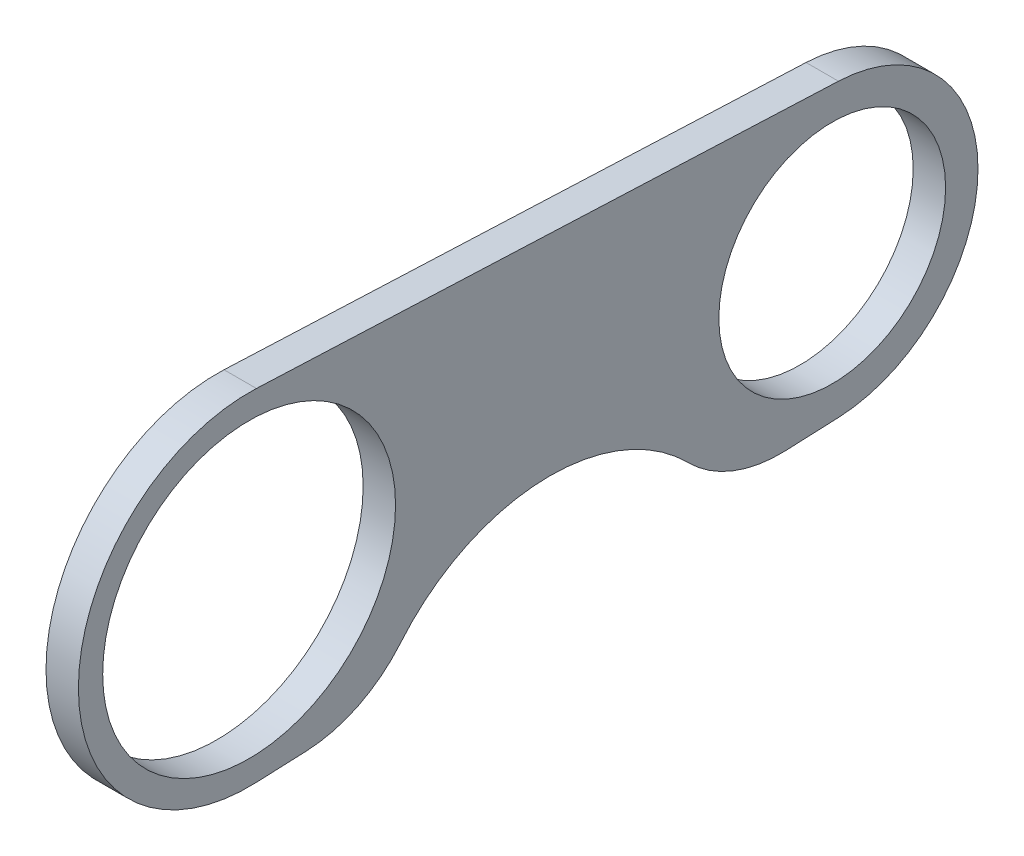
from build123d import *

# Parameters (mm, degrees)
SKETCH1_R           = 14.351
SKETCH1_R_2         = 11.1125
BOSS_EXTRUDE1_DEPTH = 3.175
SKETCH2_R           = 19.05
CUT_EXTRUDE1_DEPTH  = 49.402435038
FILLET1_R           = 12.7


with BuildPart() as part:
    # Sketch1 → Boss-Extrude1 (new body)
    with BuildSketch(Plane(origin=(0, 0, 0), x_dir=(0, 0, -1), z_dir=(1, 0, 0))):
        with BuildLine():
            Line((-27.859231528, 16.716933497), (29.1861875, 14.274421392))
            ThreePointArc((29.1861875, 14.274421392), (42.8625, 0), (29.1861875, -14.274421392))
            Line((29.1861875, -14.274421392), (-27.859231528, -16.716933497))
            ThreePointArc((-27.859231528, -16.716933497), (-45.30725, 0), (-27.859231528, 16.716933497))
        make_face()
        with Locations((-28.575, 0)):
            Circle(SKETCH1_R, mode=Mode.SUBTRACT)
        with Locations((28.575, 0)):
            Circle(SKETCH1_R_2, mode=Mode.SUBTRACT)
    extrude(amount=BOSS_EXTRUDE1_DEPTH)

    # Sketch2 → Cut-Extrude1 (cut, through all)
    with BuildSketch(Plane(origin=(3.175, 0, 0), x_dir=(0, 0, -1), z_dir=(1, 0, 0))):
        with Locations((0.909794386, -24.13)):
            Circle(SKETCH2_R)
    extrude(amount=-CUT_EXTRUDE1_DEPTH, mode=Mode.SUBTRACT)

    # Fillet1
    fillet1_edges = [part.edges().sort_by_distance(p)[0] for p in [
        (1.5875, -14.774602606, -17.504342877),
        (1.5875, -16.227298393, 16.423693644),
    ]]
    fillet(fillet1_edges, radius=FILLET1_R)


solid = part.part
